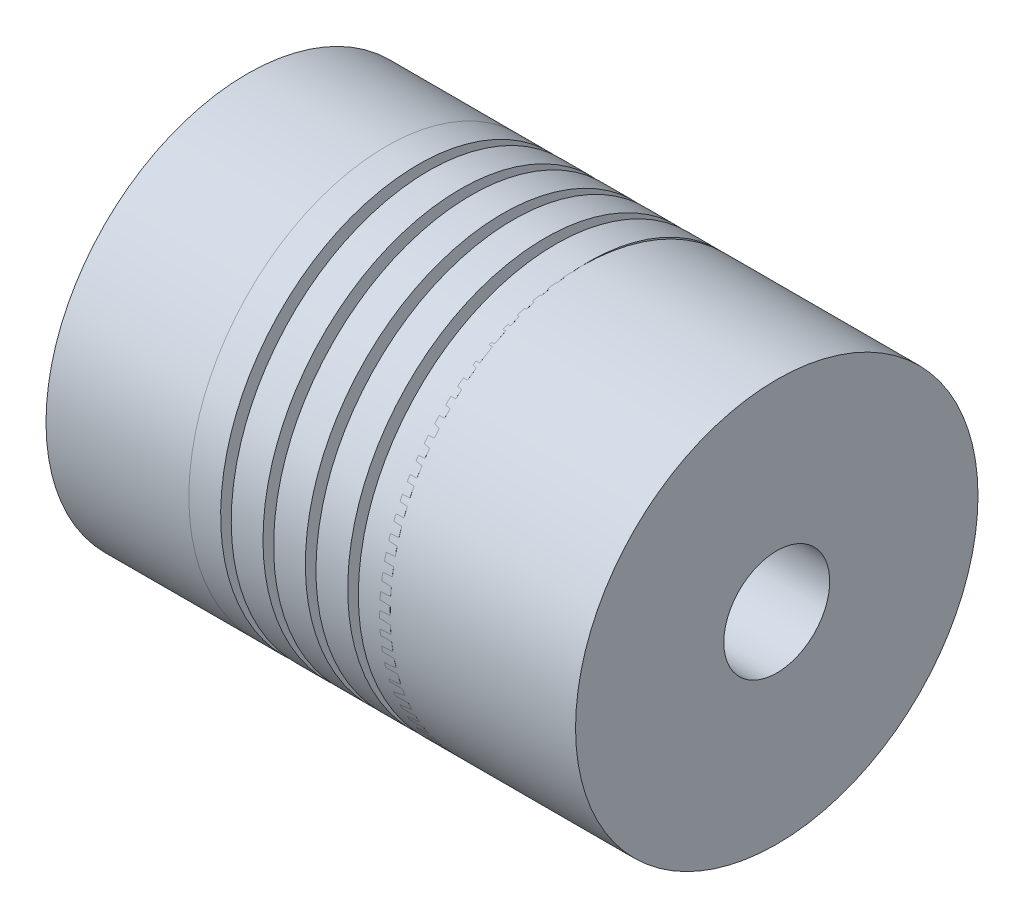
from build123d import *

# Parameters (mm, degrees)
ESBO_O1_W                = 25
ESBO_O1_H                = 2.5
VARREDURA1_PITCH         = 2
ESBO_O7_R                = 9.5
RESSALTO_EXTRUS_O3_DEPTH = 7.25
ESBO_O10_R               = 9.5
RESSALTO_EXTRUS_O5_DEPTH = 9.25
ESBO_O11_R               = 2.5
CORTE_EXTRUS_O2_DEPTH    = 32.5


with BuildPart() as part:
    # Esboço1 → Revolução1 (revolve)
    with BuildSketch(Plane.XY, mode=Mode.PRIVATE) as revolu_o1_sk:
        with Locations((12.5, 1.25)):
            Rectangle(ESBO_O1_W, ESBO_O1_H)
    revolve(revolu_o1_sk.sketch.rotate(Axis((0, 0, 0), (1, 0, 0)), 90), axis=Axis((0, 0, 0), (1, 0, 0)))

    # Varredura1: arcs per turn and ends read off the stored shape
    # Varredura1: the profile of Esboço4 profile screwed along a right-hand helix through 5 turns, 10 arcs to a turn; built about Z, then put on its axis
    varredura1_z = Axis((0, 0, 0), (0, 0, 1))
    varredura1_corners = [(9.5, 0, -1.75), (9.5, 0, -0.25), (2.4997, 0, -0.25), (2.4997, 0, -1.75)]
    with BuildLine(mode=Mode.PRIVATE) as varredura1_profile:
        Line(varredura1_corners[0], varredura1_corners[1])
        Line(varredura1_corners[1], varredura1_corners[2])
        Line(varredura1_corners[2], varredura1_corners[3])
        Line(varredura1_corners[3], varredura1_corners[0])
    varredura1_cap = Face(varredura1_profile.wire())
    varredura1_turn_angles = [0, 18, 36, 54, 72, 90, 108, 126, 144, 162, 180, 198, 216, 234, 252, 270, 288, 306, 324, 342, 360]
    varredura1_turn_weights = [1, 0.9510565162951535, 1, 0.9510565162951535, 1, 0.9510565162951535, 1, 0.9510565162951535, 1, 0.9510565162951535, 1, 0.9510565162951535, 1, 0.9510565162951535, 1, 0.9510565162951535, 1, 0.9510565162951535, 1, 0.9510565162951535, 1]
    varredura1_turn_rails = [Edge.make_bspline([Vector(p[0], p[1], 0).rotate(varredura1_z, varredura1_turn_angles[k]) / varredura1_turn_weights[k] + Vector(0, 0, p[2] + VARREDURA1_PITCH * varredura1_turn_angles[k] / 360) for k in range(21)], [0, 0, 0, 1, 1, 2, 2, 3, 3, 4, 4, 5, 5, 6, 6, 7, 7, 8, 8, 9, 9, 10, 10, 10], 2, varredura1_turn_weights) for p in varredura1_corners]
    varredura1_turn_sides = [Face.make_surface_from_curves(varredura1_turn_rails[p[0]], varredura1_turn_rails[p[1]]) for p in [(0, 1), (1, 2), (2, 3), (3, 0)]]
    varredura1 = Plane(origin=(0, 0, 0), x_dir=(0, 0, -1), z_dir=(1, 0, 0)) * Solid(Shell([*[p.moved(Location((0, 0, VARREDURA1_PITCH * i))) for i in range(5) for p in varredura1_turn_sides], varredura1_cap, varredura1_cap.rotate(varredura1_z, 1800).moved(Location((0, 0, VARREDURA1_PITCH * 1800 / 360)))]))
    add(varredura1)

    # Esboço7 → Ressalto-extrusão3 (add)
    with BuildSketch(Plane.ZY.offset(7.5)):
        Circle(ESBO_O7_R)
    extrude(amount=-RESSALTO_EXTRUS_O3_DEPTH)


with BuildPart() as body_2:
    # Esboço10 → Ressalto-extrusão5 (new body)
    with BuildSketch(Plane.ZY.offset(-17.5)):
        Circle(ESBO_O10_R)
    extrude(amount=RESSALTO_EXTRUS_O5_DEPTH)


with BuildPart() as corte_extrus_o2_tool:
    # Esboço11 → Corte-extrusão2 (new body)
    with BuildSketch(Plane.ZY.offset(7.5)):
        Circle(ESBO_O11_R)
    extrude(amount=-CORTE_EXTRUS_O2_DEPTH)


with BuildPart() as part_1:
    add(part.part)

    # Corte-extrusão2: cut by corte_extrus_o2_tool
    add(corte_extrus_o2_tool.part, mode=Mode.SUBTRACT)


with BuildPart() as body_2_1:
    add(body_2.part)

    # Corte-extrusão2: cut by corte_extrus_o2_tool
    add(corte_extrus_o2_tool.part, mode=Mode.SUBTRACT)


solid = Compound([part_1.part, body_2_1.part])
